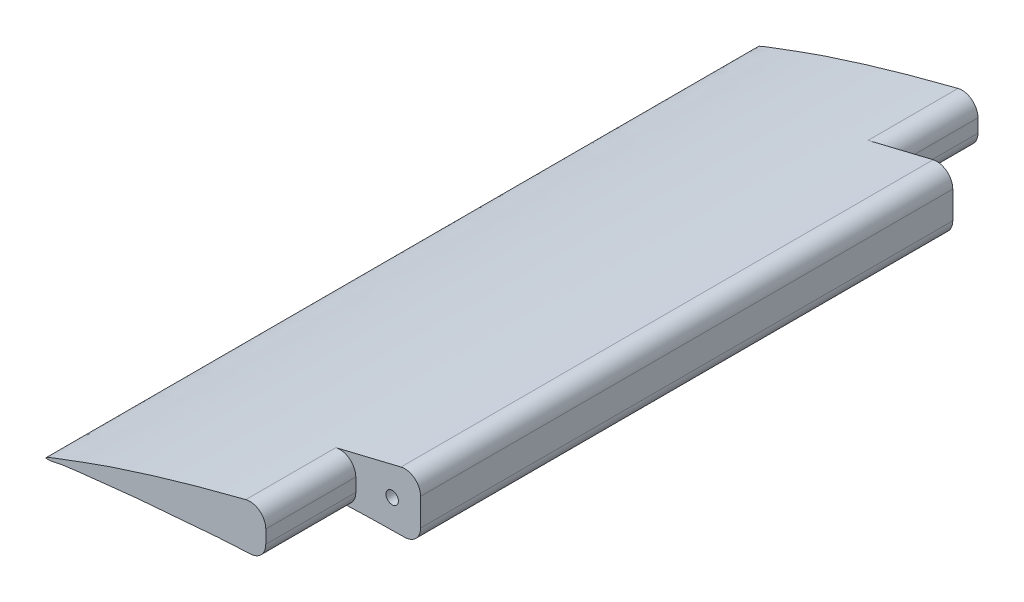
from build123d import *

# Parameters (mm, degrees)
BOSS_EXTRUDE1_DEPTH       = 226.06
CUT_EXTRUDE1_DEPTH        = 248.603669875
CUT_EXTRUDE1_DEPTH_BACK   = 248.603669875
FILLET1_R                 = 5.08
SHELL1_START              = 31.75
SHELL1_DEPTH              = 162.56
SHELL1_START_2            = 3.175
SHELL1_2_DEPTH            = 219.71
SKETCH3_R                 = 1.984375
CUT_EXTRUDE2_DEPTH        = 246.233624371
BOSS_EXTRUDE2_START       = -4.025198094
BOSS_EXTRUDE2_OUTLINE_R   = 1.5875
BOSS_EXTRUDE2_DEPTH       = 5.811624811
BOSS_EXTRUDE2_START_2     = -8.955775483
BOSS_EXTRUDE2_2_OUTLINE_R = 1.5875
BOSS_EXTRUDE2_2_DEPTH     = 4.930577389


# Read off the part's stored shape, not the designer's step: Shell1, Boss-Extrude2
with BuildPart() as part:
    # Sketch1 → Boss-Extrude1 (new body)
    with BuildSketch(Plane.XY):
        with BuildLine():
            Line((99.32639085, 18.404394796), (99.32639085, -2.986448862))
            add(Edge.make_bspline(
                [(5.047603806, -9.653713384), (9.482649657, -8.546128483), (16.988483729, -8.076906091), (30.336595099, -6.254410192), (41.946659702, -5.566037344), (65.865842143, -3.231342143), (83.974811725, -3.089086557), (99.32639085, -2.986448862)],
                knots=[0, 0, 0, 0, 0.144322392, 0.237947652, 0.42712275, 0.512831912, 1, 1, 1, 1], degree=3))
            add(Edge.make_bspline(
                [(5.047603806, -9.653713384), (1.304537033, -10.042523479), (11.503328192, -6.353494655), (19.723627138, -3.092777487), (52.915151131, 7.645918304), (77.889766355, 13.460013374), (99.32639085, 18.404394796)],
                knots=[0, 0, 0, 0, 0.059914523, 0.175786391, 0.369274689, 1, 1, 1, 1], degree=3))
        make_face()
    extrude(amount=BOSS_EXTRUDE1_DEPTH)

    # Sketch2 → Cut-Extrude1 (cut, two sides: drawn at the far end of the back side and taken through both)
    with BuildSketch(Plane(origin=(0, 0, 0), x_dir=(1, 0, 0), z_dir=(0, 1, 0)).offset(-CUT_EXTRUDE1_DEPTH_BACK)):
        Polygon((169.681502528, 0), (169.681502528, -226.06), (73.16439085, -226.06), (73.16439085, -197.485), (93.73839085, -197.485), (93.73839085, -28.575), (73.16439085, -28.575), (73.16439085, 0), align=None)
    extrude(amount=CUT_EXTRUDE1_DEPTH + CUT_EXTRUDE1_DEPTH_BACK, mode=Mode.SUBTRACT)

    # Fillet1
    fillet1_edges = [part.edges().sort_by_distance(p)[0] for p in [
        (73.16439085, -3.388889971, 14.2875),
        (73.16439085, 12.236004014, 14.2875),
        (93.73839085, -3.026654485, 113.03),
        (93.73839085, 17.113551214, 113.03),
        (73.16439085, -3.388889971, 211.7725),
        (73.16439085, 12.236004014, 211.7725),
    ]]
    fillet(fillet1_edges, radius=FILLET1_R)

    # Shell1 outline → Shell1 (cut)
    with BuildSketch(Plane.XY.offset(SHELL1_START)):
        with BuildLine():
            ThreePointArc((90.56339085, 10.716231692), (89.84210345, 12.208829924), (88.224441264, 12.571147528))
            add(Edge.make_bspline(
                [(88.224441264, 12.571147528), (87.199954726, 12.331473265), (86.178161178, 12.091844736), (85.158893539, 11.852170354), (84.141984638, 11.612358579), (83.127267128, 11.372317854), (82.11457348, 11.131956606), (81.103735991, 10.891183246), (80.094586779, 10.649906167), (79.086957782, 10.408033746), (78.080680762, 10.165474344), (77.075587303, 9.922136302), (75.365261077, 9.50615692), (74.659515429, 9.333955274), (73.95421322, 9.161291111), (73.24929575, 8.988132524), (72.544704275, 8.814447596), (71.84038, 8.640204402), (71.136264087, 8.465371009), (70.432297655, 8.289915474), (69.728421779, 8.113805846), (69.024577498, 7.937010164), (68.320705808, 7.759496459), (67.616747671, 7.581232754)],
                knots=[0.118068853, 0.118068853, 0.118068853, 0.118068853, 0.118068853, 0.118068853, 0.118068853, 0.118068853, 0.118068853, 0.118068853, 0.118068853, 0.118068853, 0.118068853, 0.242924315, 0.242924315, 0.242924315, 0.242924315, 0.242924315, 0.242924315, 0.242924315, 0.242924315, 0.242924315, 0.242924315, 0.242924315, 0.330745026, 0.330745026, 0.330745026, 0.330745026, 0.330745026, 0.330745026, 0.330745026, 0.330745026, 0.330745026, 0.330745026, 0.330745026, 0.330745026, 0.330745026], degree=12))
            ThreePointArc((67.616747671, 7.581232754), (69.254468773, 7.237834237), (69.98939085, 5.734523672))
            Line((69.98939085, 5.734523672), (69.98939085, 1.506513014))
            ThreePointArc((69.98939085, 1.506513014), (69.459523341, 0.188167221), (68.164681525, -0.396794214))
            add(Edge.make_bspline(
                [(68.164681525, -0.396794214), (68.694992172, -0.374423154), (69.225275053, -0.352727917), (69.755528584, -0.331695291), (70.285751179, -0.311312074), (70.815941255, -0.291565067), (71.346097229, -0.272441078), (71.876217523, -0.25392692), (72.406300557, -0.236009412), (72.936344753, -0.218675382), (73.466348538, -0.201911658), (73.996310335, -0.18570508), (74.526228574, -0.170042489), (75.056101682, -0.154910735), (76.522372139, -0.114466983), (77.45867021, -0.090254504), (78.394813662, -0.06758666), (79.330793845, -0.046390933), (80.266602102, -0.026594862), (81.202229769, -0.008126042), (82.137668173, 0.009087874), (83.072908636, 0.025119175), (84.007942471, 0.040040096), (84.942760983, 0.053922812), (85.87735547, 0.066839443), (86.811717225, 0.07886205), (87.74583753, 0.09006264), (88.679707661, 0.100513159)],
                knots=[0.67202474, 0.67202474, 0.67202474, 0.67202474, 0.67202474, 0.67202474, 0.67202474, 0.67202474, 0.67202474, 0.67202474, 0.67202474, 0.67202474, 0.67202474, 0.67202474, 0.67202474, 0.75, 0.75, 0.75, 0.75, 0.75, 0.75, 0.75, 0.75, 0.75, 0.75, 0.75, 0.75, 0.75, 0.887817721, 0.887817721, 0.887817721, 0.887817721, 0.887817721, 0.887817721, 0.887817721, 0.887817721, 0.887817721, 0.887817721, 0.887817721, 0.887817721, 0.887817721, 0.887817721, 0.887817721], degree=14))
            ThreePointArc((88.679707661, 0.100513159), (90.012944885, 0.665913267), (90.56339085, 2.0053939))
            Line((90.56339085, 2.0053939), (90.56339085, 10.716231692))
        make_face()
        with BuildLine():
            ThreePointArc((69.98939085, 5.734523672), (69.254468773, 7.237834237), (67.616747644, 7.581232862))
            add(Edge.make_bspline(
                [(67.616747644, 7.581232862), (65.399836461, 7.019843113), (63.182067917, 6.451015332), (60.961598132, 5.873750666), (58.736579605, 5.2870495), (56.505161763, 4.689911333), (54.265491496, 4.081334769), (52.015713682, 3.460317509), (49.753971716, 2.825856339), (47.478408044, 2.176947117), (45.187164685, 1.512584769), (42.878383765, 0.831763272), (40.358491497, 0.075974277), (40.166643435, 0.018354472), (39.974662823, -0.039384328), (39.782548624, -0.097242688), (39.590299803, -0.155221168), (39.397915321, -0.213320331), (39.205394144, -0.271540739), (39.012735233, -0.329882954), (38.819937552, -0.388347539), (38.627000064, -0.446935056), (38.433921733, -0.505646067), (38.047481311, -0.6233162), (37.854115889, -0.68227633), (37.660618706, -0.741357704), (37.46700324, -0.800556496), (37.273282999, -0.859868869), (37.079471514, -0.919290978), (36.885582349, -0.97881897), (36.69162909, -1.038448983), (36.497625354, -1.098177145), (36.303584785, -1.157999576), (36.109521054, -1.217912388), (35.527301471, -1.397910273), (35.139116839, -1.518254909), (34.751002758, -1.638914656), (34.363068079, -1.759858551), (33.975421705, -1.881055606), (33.588172595, -2.002474805), (33.20142976, -2.124085105), (32.815302268, -2.245855438), (32.429899238, -2.367754709), (32.045329846, -2.489751794), (31.66170332, -2.611815547), (31.123971117, -2.783433666), (30.968986334, -2.832958389), (30.814181899, -2.882486873), (30.659565113, -2.93201703), (30.505143284, -2.981546776), (30.350923715, -3.031074022), (30.196913716, -3.080596682), (30.043120596, -3.130112665), (29.889551668, -3.179619883), (29.736214245, -3.229116246), (29.583115647, -3.27859966), (29.430263192, -3.328068033)],
                knots=[0.330745026, 0.330745026, 0.330745026, 0.330745026, 0.330745026, 0.330745026, 0.330745026, 0.330745026, 0.330745026, 0.330745026, 0.330745026, 0.330745026, 0.330745026, 0.607310788, 0.607310788, 0.607310788, 0.607310788, 0.607310788, 0.607310788, 0.607310788, 0.607310788, 0.607310788, 0.607310788, 0.607310788, 0.630084943, 0.630084943, 0.630084943, 0.630084943, 0.630084943, 0.630084943, 0.630084943, 0.630084943, 0.630084943, 0.630084943, 0.630084943, 0.652859097, 0.652859097, 0.652859097, 0.652859097, 0.652859097, 0.652859097, 0.652859097, 0.652859097, 0.652859097, 0.652859097, 0.652859097, 0.698407406, 0.698407406, 0.698407406, 0.698407406, 0.698407406, 0.698407406, 0.698407406, 0.698407406, 0.698407406, 0.698407406, 0.698407406, 0.716880093, 0.716880093, 0.716880093, 0.716880093, 0.716880093, 0.716880093, 0.716880093, 0.716880093, 0.716880093, 0.716880093, 0.716880093, 0.716880093, 0.716880093], degree=12))
            add(Edge.make_bspline(
                [(29.430263192, -3.328068033), (30.192321788, -3.253103705), (30.953742852, -3.181055792), (31.714498333, -3.111652976), (32.474560286, -3.044625223), (33.233901052, -2.979703638), (33.992493217, -2.916620464), (34.750309569, -2.855109092), (35.507323058, -2.794904058), (36.26350675, -2.735741051), (37.018833789, -2.677356913), (37.77327735, -2.619489644), (38.526810601, -2.561878406), (39.27940666, -2.504263523), (40.241275886, -2.430197827), (40.451437795, -2.413988578), (40.661523692, -2.397753121), (40.871532992, -2.381485838), (41.081465111, -2.36518111), (41.291319462, -2.34883332), (41.501095461, -2.332436848), (41.710792523, -2.315986075), (41.920410064, -2.299475384), (42.129947497, -2.282899155), (42.339404239, -2.266251771), (42.548779704, -2.249527611), (42.758073307, -2.232721059), (43.071890042, -2.207379213), (43.176475009, -2.198909942), (43.281039293, -2.190417989), (43.38558282, -2.181902656), (43.490105518, -2.173363251), (43.594607315, -2.164799076), (43.699088138, -2.156209439), (43.803547915, -2.147593642), (43.907986571, -2.138950992), (44.012404037, -2.130280793), (44.116800238, -2.12158235), (44.221175102, -2.112854969), (44.325528557, -2.104097954), (44.482026516, -2.090916937), (44.534185416, -2.08651578), (44.586353102, -2.082106088), (44.638462372, -2.077692142), (44.690677468, -2.073262507), (44.74276457, -2.068834253), (44.79486261, -2.064396055), (44.84709011, -2.05993977), (44.899190406, -2.055485443), (44.951182515, -2.051030032), (45.003429676, -2.046545196), (45.055514905, -2.042065555), (45.107662823, -2.037572174), (45.211955574, -2.028569312), (45.264108442, -2.024059127), (45.316267814, -2.019540326), (45.368433702, -2.015013048), (45.42060612, -2.010477431), (45.472785076, -2.005933613), (45.524970589, -2.001381732), (45.577162664, -1.996821927), (45.629361319, -1.992254336), (45.681566563, -1.987679097), (45.73377841, -1.983096348), (45.785996871, -1.978506228), (45.838221958, -1.973908876), (46.3083075, -1.93246885), (46.726586222, -1.895179261), (47.145296128, -1.857506655), (47.564443519, -1.819522312), (47.98403472, -1.781297798), (48.404076086, -1.742904961), (48.824573993, -1.704415937), (49.24553485, -1.665903148), (49.66696508, -1.627439299), (50.088871145, -1.589097383), (50.511259522, -1.550950675), (50.934136722, -1.513072738), (51.357509275, -1.47553742), (51.834368049, -1.433779033), (51.8873602, -1.429145723), (51.940360205, -1.424519069), (51.993368079, -1.419899217), (52.046383832, -1.415286311), (52.099407479, -1.410680497), (52.152439032, -1.40608192), (52.205478504, -1.401490725), (52.258525908, -1.396907058), (52.311581256, -1.392331062), (52.364644562, -1.387762884), (52.417715838, -1.38320267), (52.470795096, -1.378650563), (52.576969604, -1.369562855), (52.630062039, -1.365027462), (52.683179331, -1.360499209), (52.736263003, -1.355982684), (52.78940087, -1.351471194), (52.842545574, -1.346968801), (52.895651993, -1.342479031), (52.948780943, -1.337996995), (53.001972248, -1.333519945), (53.055147327, -1.329054684), (53.108262643, -1.324604451), (53.161436979, -1.320159017), (53.214588182, -1.31572572), (53.37405314, -1.302454763), (53.48036356, -1.293647424), (53.586674415, -1.284879943), (53.692985692, -1.276152212), (53.799297377, -1.267464124), (53.905609457, -1.258815573), (54.011921919, -1.25020645), (54.118234749, -1.241636649), (54.224547934, -1.233106063), (54.330861461, -1.224614583), (54.437175316, -1.216162103), (54.543489487, -1.207748516), (54.649803959, -1.199373714), (54.96874824, -1.174365343), (55.181378913, -1.157847807), (55.394010633, -1.141484125), (55.606643294, -1.125273441), (55.819276791, -1.109214898), (56.031911017, -1.093307639), (56.244545869, -1.077550807), (56.457181238, -1.061943545), (56.669817021, -1.046484998), (56.882453112, -1.031174307), (57.095089404, -1.016010616), (57.307725793, -1.000993068), (57.520362172, -0.986120806), (58.158270965, -0.941937311), (58.583543022, -0.913059346), (59.008813776, -0.884752245), (59.434082397, -0.857009171), (59.859348051, -0.829823289), (60.284609909, -0.803187765), (60.709867137, -0.777095761), (61.135118907, -0.751540443), (61.560364383, -0.726514975), (61.985602738, -0.702012521), (62.410833137, -0.678026246), (62.83605475, -0.654549315), (63.261266746, -0.631574892), (64.006388166, -0.592183223), (64.32630213, -0.575550919), (64.646209835, -0.559196323), (64.96611093, -0.543116532), (65.286005067, -0.527308639), (65.605891895, -0.511769741), (65.925771064, -0.496496937), (66.245642227, -0.481487322), (66.565505034, -0.466737997), (66.885359135, -0.45224606), (67.205204184, -0.438008612), (67.52503983, -0.424022754), (67.844865727, -0.410285587), (68.164681525, -0.396794215)],
                knots=[0.263276283, 0.263276283, 0.263276283, 0.263276283, 0.263276283, 0.263276283, 0.263276283, 0.263276283, 0.263276283, 0.263276283, 0.263276283, 0.263276283, 0.263276283, 0.263276283, 0.263276283, 0.375, 0.375, 0.375, 0.375, 0.375, 0.375, 0.375, 0.375, 0.375, 0.375, 0.375, 0.375, 0.375, 0.40625, 0.40625, 0.40625, 0.40625, 0.40625, 0.40625, 0.40625, 0.40625, 0.40625, 0.40625, 0.40625, 0.40625, 0.40625, 0.421875, 0.421875, 0.421875, 0.421875, 0.421875, 0.421875, 0.421875, 0.421875, 0.421875, 0.421875, 0.421875, 0.421875, 0.421875, 0.4296875, 0.4296875, 0.4296875, 0.4296875, 0.4296875, 0.4296875, 0.4296875, 0.4296875, 0.4296875, 0.4296875, 0.4296875, 0.4296875, 0.4296875, 0.4375, 0.4375, 0.4375, 0.4375, 0.4375, 0.4375, 0.4375, 0.4375, 0.4375, 0.4375, 0.4375, 0.4375, 0.4375, 0.5, 0.5, 0.5, 0.5, 0.5, 0.5, 0.5, 0.5, 0.5, 0.5, 0.5, 0.5, 0.5, 0.5078125, 0.5078125, 0.5078125, 0.5078125, 0.5078125, 0.5078125, 0.5078125, 0.5078125, 0.5078125, 0.5078125, 0.5078125, 0.5078125, 0.5078125, 0.515625, 0.515625, 0.515625, 0.515625, 0.515625, 0.515625, 0.515625, 0.515625, 0.515625, 0.515625, 0.515625, 0.515625, 0.515625, 0.53125, 0.53125, 0.53125, 0.53125, 0.53125, 0.53125, 0.53125, 0.53125, 0.53125, 0.53125, 0.53125, 0.53125, 0.53125, 0.5625, 0.5625, 0.5625, 0.5625, 0.5625, 0.5625, 0.5625, 0.5625, 0.5625, 0.5625, 0.5625, 0.5625, 0.5625, 0.625, 0.625, 0.625, 0.625, 0.625, 0.625, 0.625, 0.625, 0.625, 0.625, 0.625, 0.625, 0.625, 0.67202474, 0.67202474, 0.67202474, 0.67202474, 0.67202474, 0.67202474, 0.67202474, 0.67202474, 0.67202474, 0.67202474, 0.67202474, 0.67202474, 0.67202474, 0.67202474, 0.67202474], degree=14))
            ThreePointArc((68.164681525, -0.396794215), (69.459523341, 0.188167221), (69.98939085, 1.506513014))
            Line((69.98939085, 1.506513014), (69.98939085, 5.734523672))
        make_face()
    extrude(amount=SHELL1_DEPTH, mode=Mode.SUBTRACT)

    # Shell1 2 outline → Shell1 2 (cut)
    with BuildSketch(Plane.XY.offset(SHELL1_START_2)):
        with BuildLine():
            ThreePointArc((69.98939085, 5.734523672), (69.254468773, 7.237834237), (67.616747644, 7.581232862))
            add(Edge.make_bspline(
                [(67.616747644, 7.581232862), (65.399836461, 7.019843113), (63.182067917, 6.451015332), (60.961598132, 5.873750666), (58.736579605, 5.2870495), (56.505161763, 4.689911333), (54.265491496, 4.081334769), (52.015713682, 3.460317509), (49.753971716, 2.825856339), (47.478408044, 2.176947117), (45.187164685, 1.512584769), (42.878383765, 0.831763272), (40.358491497, 0.075974277), (40.166643435, 0.018354472), (39.974662823, -0.039384328), (39.782548624, -0.097242688), (39.590299803, -0.155221168), (39.397915321, -0.213320331), (39.205394144, -0.271540739), (39.012735233, -0.329882954), (38.819937552, -0.388347539), (38.627000064, -0.446935056), (38.433921733, -0.505646067), (38.047481311, -0.6233162), (37.854115889, -0.68227633), (37.660618706, -0.741357704), (37.46700324, -0.800556496), (37.273282999, -0.859868869), (37.079471514, -0.919290978), (36.885582349, -0.97881897), (36.69162909, -1.038448983), (36.497625354, -1.098177145), (36.303584785, -1.157999576), (36.109521054, -1.217912388), (35.527301471, -1.397910273), (35.139116839, -1.518254909), (34.751002758, -1.638914656), (34.363068079, -1.759858551), (33.975421705, -1.881055606), (33.588172595, -2.002474805), (33.20142976, -2.124085105), (32.815302268, -2.245855438), (32.429899238, -2.367754709), (32.045329846, -2.489751794), (31.66170332, -2.611815547), (31.123971117, -2.783433666), (30.968986334, -2.832958389), (30.814181899, -2.882486873), (30.659565113, -2.93201703), (30.505143284, -2.981546776), (30.350923715, -3.031074022), (30.196913716, -3.080596682), (30.043120596, -3.130112665), (29.889551668, -3.179619883), (29.736214245, -3.229116246), (29.583115647, -3.27859966), (29.430263192, -3.328068033)],
                knots=[0.330745026, 0.330745026, 0.330745026, 0.330745026, 0.330745026, 0.330745026, 0.330745026, 0.330745026, 0.330745026, 0.330745026, 0.330745026, 0.330745026, 0.330745026, 0.607310788, 0.607310788, 0.607310788, 0.607310788, 0.607310788, 0.607310788, 0.607310788, 0.607310788, 0.607310788, 0.607310788, 0.607310788, 0.630084943, 0.630084943, 0.630084943, 0.630084943, 0.630084943, 0.630084943, 0.630084943, 0.630084943, 0.630084943, 0.630084943, 0.630084943, 0.652859097, 0.652859097, 0.652859097, 0.652859097, 0.652859097, 0.652859097, 0.652859097, 0.652859097, 0.652859097, 0.652859097, 0.652859097, 0.698407406, 0.698407406, 0.698407406, 0.698407406, 0.698407406, 0.698407406, 0.698407406, 0.698407406, 0.698407406, 0.698407406, 0.698407406, 0.716880093, 0.716880093, 0.716880093, 0.716880093, 0.716880093, 0.716880093, 0.716880093, 0.716880093, 0.716880093, 0.716880093, 0.716880093, 0.716880093, 0.716880093], degree=12))
            add(Edge.make_bspline(
                [(29.430263192, -3.328068033), (30.192321788, -3.253103705), (30.953742852, -3.181055792), (31.714498333, -3.111652976), (32.474560286, -3.044625223), (33.233901052, -2.979703638), (33.992493217, -2.916620464), (34.750309569, -2.855109092), (35.507323058, -2.794904058), (36.26350675, -2.735741051), (37.018833789, -2.677356913), (37.77327735, -2.619489644), (38.526810601, -2.561878406), (39.27940666, -2.504263523), (40.241275886, -2.430197827), (40.451437795, -2.413988578), (40.661523692, -2.397753121), (40.871532992, -2.381485838), (41.081465111, -2.36518111), (41.291319462, -2.34883332), (41.501095461, -2.332436848), (41.710792523, -2.315986075), (41.920410064, -2.299475384), (42.129947497, -2.282899155), (42.339404239, -2.266251771), (42.548779704, -2.249527611), (42.758073307, -2.232721059), (43.071890042, -2.207379213), (43.176475009, -2.198909942), (43.281039293, -2.190417989), (43.38558282, -2.181902656), (43.490105518, -2.173363251), (43.594607315, -2.164799076), (43.699088138, -2.156209439), (43.803547915, -2.147593642), (43.907986571, -2.138950992), (44.012404037, -2.130280793), (44.116800238, -2.12158235), (44.221175102, -2.112854969), (44.325528557, -2.104097954), (44.482026516, -2.090916937), (44.534185416, -2.08651578), (44.586353102, -2.082106088), (44.638462372, -2.077692142), (44.690677468, -2.073262507), (44.74276457, -2.068834253), (44.79486261, -2.064396055), (44.84709011, -2.05993977), (44.899190406, -2.055485443), (44.951182515, -2.051030032), (45.003429676, -2.046545196), (45.055514905, -2.042065555), (45.107662823, -2.037572174), (45.211955574, -2.028569312), (45.264108442, -2.024059127), (45.316267814, -2.019540326), (45.368433702, -2.015013048), (45.42060612, -2.010477431), (45.472785076, -2.005933613), (45.524970589, -2.001381732), (45.577162664, -1.996821927), (45.629361319, -1.992254336), (45.681566563, -1.987679097), (45.73377841, -1.983096348), (45.785996871, -1.978506228), (45.838221958, -1.973908876), (46.3083075, -1.93246885), (46.726586222, -1.895179261), (47.145296128, -1.857506655), (47.564443519, -1.819522312), (47.98403472, -1.781297798), (48.404076086, -1.742904961), (48.824573993, -1.704415937), (49.24553485, -1.665903148), (49.66696508, -1.627439299), (50.088871145, -1.589097383), (50.511259522, -1.550950675), (50.934136722, -1.513072738), (51.357509275, -1.47553742), (51.834368049, -1.433779033), (51.8873602, -1.429145723), (51.940360205, -1.424519069), (51.993368079, -1.419899217), (52.046383832, -1.415286311), (52.099407479, -1.410680497), (52.152439032, -1.40608192), (52.205478504, -1.401490725), (52.258525908, -1.396907058), (52.311581256, -1.392331062), (52.364644562, -1.387762884), (52.417715838, -1.38320267), (52.470795096, -1.378650563), (52.576969604, -1.369562855), (52.630062039, -1.365027462), (52.683179331, -1.360499209), (52.736263003, -1.355982684), (52.78940087, -1.351471194), (52.842545574, -1.346968801), (52.895651993, -1.342479031), (52.948780943, -1.337996995), (53.001972248, -1.333519945), (53.055147327, -1.329054684), (53.108262643, -1.324604451), (53.161436979, -1.320159017), (53.214588182, -1.31572572), (53.37405314, -1.302454763), (53.48036356, -1.293647424), (53.586674415, -1.284879943), (53.692985692, -1.276152212), (53.799297377, -1.267464124), (53.905609457, -1.258815573), (54.011921919, -1.25020645), (54.118234749, -1.241636649), (54.224547934, -1.233106063), (54.330861461, -1.224614583), (54.437175316, -1.216162103), (54.543489487, -1.207748516), (54.649803959, -1.199373714), (54.96874824, -1.174365343), (55.181378913, -1.157847807), (55.394010633, -1.141484125), (55.606643294, -1.125273441), (55.819276791, -1.109214898), (56.031911017, -1.093307639), (56.244545869, -1.077550807), (56.457181238, -1.061943545), (56.669817021, -1.046484998), (56.882453112, -1.031174307), (57.095089404, -1.016010616), (57.307725793, -1.000993068), (57.520362172, -0.986120806), (58.158270965, -0.941937311), (58.583543022, -0.913059346), (59.008813776, -0.884752245), (59.434082397, -0.857009171), (59.859348051, -0.829823289), (60.284609909, -0.803187765), (60.709867137, -0.777095761), (61.135118907, -0.751540443), (61.560364383, -0.726514975), (61.985602738, -0.702012521), (62.410833137, -0.678026246), (62.83605475, -0.654549315), (63.261266746, -0.631574892), (64.006388166, -0.592183223), (64.32630213, -0.575550919), (64.646209835, -0.559196323), (64.96611093, -0.543116532), (65.286005067, -0.527308639), (65.605891895, -0.511769741), (65.925771064, -0.496496937), (66.245642227, -0.481487322), (66.565505034, -0.466737997), (66.885359135, -0.45224606), (67.205204184, -0.438008612), (67.52503983, -0.424022754), (67.844865727, -0.410285587), (68.164681525, -0.396794215)],
                knots=[0.263276283, 0.263276283, 0.263276283, 0.263276283, 0.263276283, 0.263276283, 0.263276283, 0.263276283, 0.263276283, 0.263276283, 0.263276283, 0.263276283, 0.263276283, 0.263276283, 0.263276283, 0.375, 0.375, 0.375, 0.375, 0.375, 0.375, 0.375, 0.375, 0.375, 0.375, 0.375, 0.375, 0.375, 0.40625, 0.40625, 0.40625, 0.40625, 0.40625, 0.40625, 0.40625, 0.40625, 0.40625, 0.40625, 0.40625, 0.40625, 0.40625, 0.421875, 0.421875, 0.421875, 0.421875, 0.421875, 0.421875, 0.421875, 0.421875, 0.421875, 0.421875, 0.421875, 0.421875, 0.421875, 0.4296875, 0.4296875, 0.4296875, 0.4296875, 0.4296875, 0.4296875, 0.4296875, 0.4296875, 0.4296875, 0.4296875, 0.4296875, 0.4296875, 0.4296875, 0.4375, 0.4375, 0.4375, 0.4375, 0.4375, 0.4375, 0.4375, 0.4375, 0.4375, 0.4375, 0.4375, 0.4375, 0.4375, 0.5, 0.5, 0.5, 0.5, 0.5, 0.5, 0.5, 0.5, 0.5, 0.5, 0.5, 0.5, 0.5, 0.5078125, 0.5078125, 0.5078125, 0.5078125, 0.5078125, 0.5078125, 0.5078125, 0.5078125, 0.5078125, 0.5078125, 0.5078125, 0.5078125, 0.5078125, 0.515625, 0.515625, 0.515625, 0.515625, 0.515625, 0.515625, 0.515625, 0.515625, 0.515625, 0.515625, 0.515625, 0.515625, 0.515625, 0.53125, 0.53125, 0.53125, 0.53125, 0.53125, 0.53125, 0.53125, 0.53125, 0.53125, 0.53125, 0.53125, 0.53125, 0.53125, 0.5625, 0.5625, 0.5625, 0.5625, 0.5625, 0.5625, 0.5625, 0.5625, 0.5625, 0.5625, 0.5625, 0.5625, 0.5625, 0.625, 0.625, 0.625, 0.625, 0.625, 0.625, 0.625, 0.625, 0.625, 0.625, 0.625, 0.625, 0.625, 0.67202474, 0.67202474, 0.67202474, 0.67202474, 0.67202474, 0.67202474, 0.67202474, 0.67202474, 0.67202474, 0.67202474, 0.67202474, 0.67202474, 0.67202474, 0.67202474, 0.67202474], degree=14))
            ThreePointArc((68.164681525, -0.396794215), (69.459523341, 0.188167221), (69.98939085, 1.506513014))
            Line((69.98939085, 1.506513014), (69.98939085, 5.734523672))
        make_face()
    extrude(amount=SHELL1_2_DEPTH, mode=Mode.SUBTRACT)

    # Sketch3 → Cut-Extrude2 (cut, through all)
    with BuildSketch(Plane.XY):
        with Locations(Location((84.713563037, 5.874854857, 0), (0, 0, 180))):
            Circle(SKETCH3_R)
    extrude(amount=CUT_EXTRUDE2_DEPTH, mode=Mode.SUBTRACT)

    # Boss-Extrude2 outline → Boss-Extrude2 (add)
    with BuildSketch(Plane(origin=(0, 0.100513169, 0), x_dir=(0, 0, 1), z_dir=(0, -1, 0)).offset(BOSS_EXTRUDE2_START)):
        with Locations((50.8, -50.615235316)):
            Circle(BOSS_EXTRUDE2_OUTLINE_R)
        with Locations((126.965977315, -52.892053199)):
            Circle(BOSS_EXTRUDE2_OUTLINE_R)
        with Locations((203.16597731, -52.892933198)):
            Circle(BOSS_EXTRUDE2_OUTLINE_R)
        with Locations((76.2, -69.665235316)):
            Circle(BOSS_EXTRUDE2_OUTLINE_R)
        with Locations((152.365977315, -71.942053199)):
            Circle(BOSS_EXTRUDE2_OUTLINE_R)
    extrude(amount=BOSS_EXTRUDE2_DEPTH)

    # Boss-Extrude2 2 outline → Boss-Extrude2 2 (add)
    with BuildSketch(Plane(origin=(0, 0.100513169, 0), x_dir=(0, 0, 1), z_dir=(0, -1, 0)).offset(BOSS_EXTRUDE2_START_2)):
        with Locations((76.2, -69.665235316)):
            Circle(BOSS_EXTRUDE2_2_OUTLINE_R)
        with Locations((152.365977315, -71.942053199)):
            Circle(BOSS_EXTRUDE2_2_OUTLINE_R)
    extrude(amount=BOSS_EXTRUDE2_2_DEPTH)


solid = part.part
